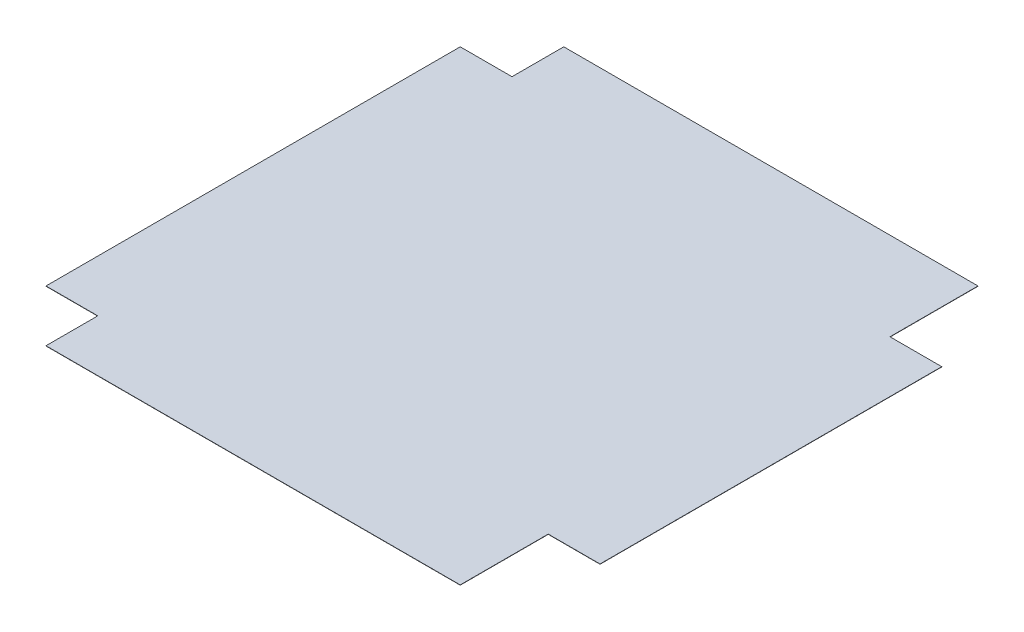
from build123d import *

# Parameters (mm, degrees)
BOSS_EXTRUDE1_DEPTH = 0.05


with BuildPart() as part:
    # Sketch1 → Boss-Extrude1 (new, symmetric)
    with BuildSketch(Plane(origin=(0, 0, 0), x_dir=(1, 0, 0), z_dir=(0, 1, 0))):
        Polygon((-80, 100), (80, 100), (80, 66), (100, 66), (100, -66), (80, -66), (80, -100), (-80, -100), (-80, -80), (-100, -80), (-100, 80), (-80, 80), align=None)
    extrude(amount=BOSS_EXTRUDE1_DEPTH, both=True)


solid = part.part
